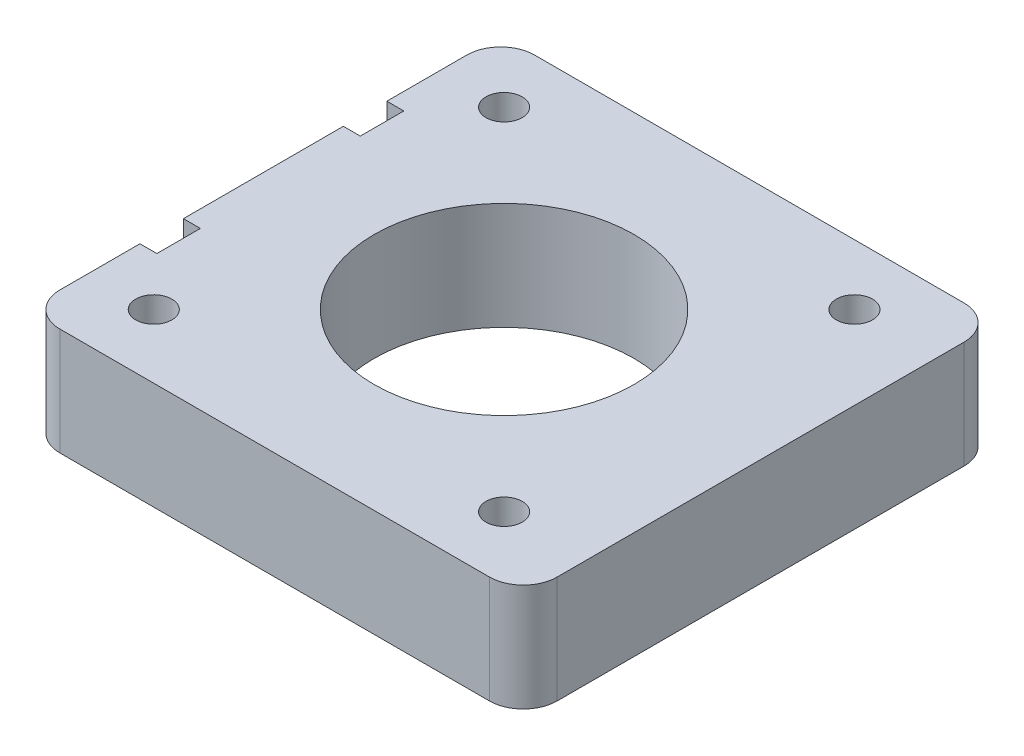
from build123d import *

# Parameters (mm, degrees)
SKETCH_1_W          = 44
SKETCH_1_H          = 42
EXTRUDE_1_DEPTH     = 9.5
SKETCH_2_R          = 11.5
CUT_EXTRUDE_1_DEPTH = 62.565006294
FILLET_1_R          = 3
SKETCH_5_R          = 1.6
CUT_EXTRUDE_2_DEPTH = 62.565006294
SKETCH_8_W          = 3.85
SKETCH_8_H          = 9.5
CUT_EXTRUDE_3_DEPTH = 1.5


with BuildPart() as part:
    # 草图1 → 凸台-拉伸1 (new body)
    with BuildSketch(Plane(origin=(0, 0, 0), x_dir=(1, 0, 0), z_dir=(0, 1, 0))):
        with Locations((22, -21)):
            Rectangle(SKETCH_1_W, SKETCH_1_H)
    extrude(amount=EXTRUDE_1_DEPTH)

    # 草图2 → 切除-拉伸1 (cut, through all)
    with BuildSketch(Plane(origin=(0, 9.5, 0), x_dir=(1, 0, 0), z_dir=(0, 1, 0))):
        with Locations((21.15, -20.85)):
            Circle(SKETCH_2_R)
    extrude(amount=-CUT_EXTRUDE_1_DEPTH, mode=Mode.SUBTRACT)

    # 圆角1
    fillet_1_edges = [part.edges().sort_by_distance(p)[0] for p in [
        (44, 4.75, 0),
        (0, 4.75, 0),
        (0, 4.75, 42),
        (44, 4.75, 42),
    ]]
    fillet(fillet_1_edges, radius=FILLET_1_R)

    # 草图5 → 切除-拉伸2 (cut, through all)
    with BuildSketch(Plane.XZ):
        with Locations((36.65, 36.35)):
            Circle(SKETCH_5_R)
        with Locations((5.65, 36.35)):
            Circle(SKETCH_5_R)
        with Locations((5.65, 5.35)):
            Circle(SKETCH_5_R)
        with Locations((36.65, 5.35)):
            Circle(SKETCH_5_R)
    extrude(amount=-CUT_EXTRUDE_2_DEPTH, mode=Mode.SUBTRACT)

    # 草图8 → 切除-拉伸3 (cut)
    with BuildSketch(Plane.ZY):
        with Locations((12, 4.75)):
            Rectangle(SKETCH_8_W, SKETCH_8_H)
        with Locations((30, 4.75)):
            Rectangle(SKETCH_8_W, SKETCH_8_H)
    extrude(amount=-CUT_EXTRUDE_3_DEPTH, mode=Mode.SUBTRACT)


solid = part.part
